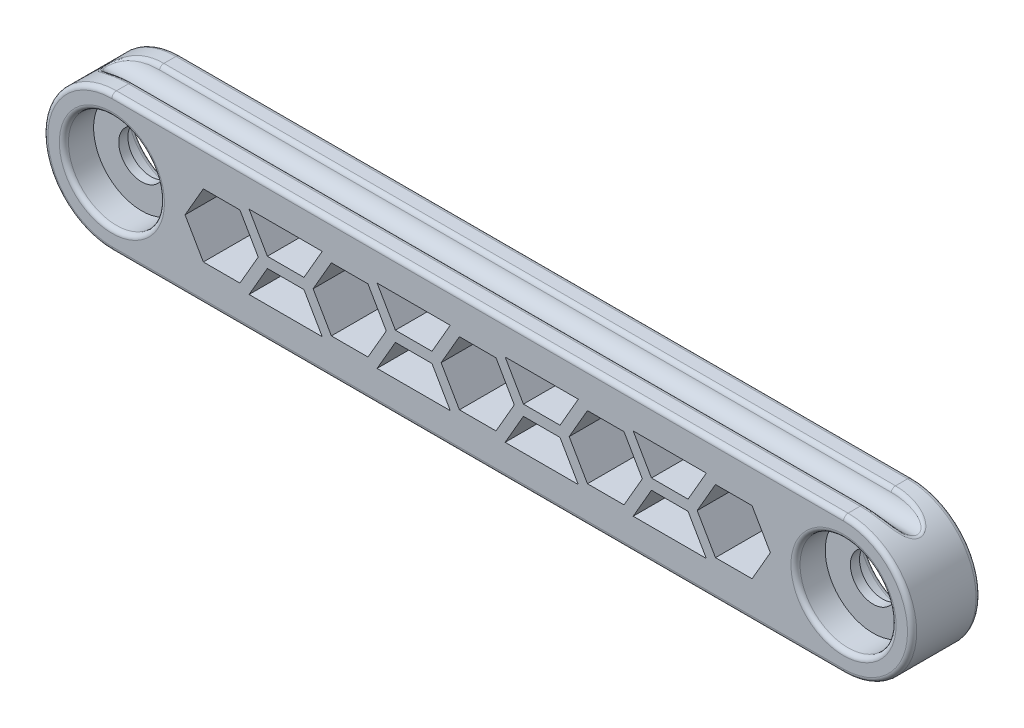
from build123d import *

# Parameters (mm, degrees)
SKETCH1_R               = 5
BOSS_EXTRUDE1_DEPTH     = 1
SKETCH1_3_R             = 10.5
BOSS_EXTRUDE2_DEPTH     = 7.5
CUT_EXTRUDE1_DEPTH      = 97.468906908
CUT_EXTRUDE1_DEPTH_BACK = 97.468906908
FILLET1_R               = 1
FILLET2_R               = 1
CUT_EXTRUDE3_DEPTH      = 97.468907022
CUT_EXTRUDE4_DEPTH      = 97.468907022
LPATTERN1_COUNT         = 3
LPATTERN1_PITCH         = 28
LPATTERN1_COUNT_DIR2    = 3
LPATTERN1_PITCH_DIR2    = 28
LPATTERN2_COUNT         = 2
LPATTERN2_PITCH         = 28
LPATTERN2_COUNT_DIR2    = 3
LPATTERN2_PITCH_DIR2    = 28


with BuildPart() as part:
    # Sketch1 → Boss-Extrude1 (new, symmetric)
    with BuildSketch(Plane.XY):
        with BuildLine():
            Line((80, 15), (-80, 15))
            ThreePointArc((-80, 15), (-95, 0), (-80, -15))
            Line((-80, -15), (80, -15))
            ThreePointArc((80, -15), (95, 0), (80, 15))
        make_face()
        with Locations((-80, 0)):
            Circle(SKETCH1_R, mode=Mode.SUBTRACT)
        with Locations((80, 0)):
            Circle(SKETCH1_R, mode=Mode.SUBTRACT)
    extrude(amount=BOSS_EXTRUDE1_DEPTH, both=True)

    # Sketch1<3> → Boss-Extrude2 (add, symmetric)
    with BuildSketch(Plane.XY):
        with BuildLine():
            Line((80, 15), (-80, 15))
            ThreePointArc((-80, 15), (-95, 0), (-80, -15))
            Line((-80, -15), (80, -15))
            ThreePointArc((80, -15), (95, 0), (80, 15))
        make_face()
        with Locations((-80, 0)):
            Circle(SKETCH1_3_R, mode=Mode.SUBTRACT)
        with Locations((80, 0)):
            Circle(SKETCH1_3_R, mode=Mode.SUBTRACT)
    extrude(amount=BOSS_EXTRUDE2_DEPTH, both=True)

    # Sketch2 → Cut-Extrude1 (cut, two sides: drawn at the far end of the back side and taken through both)
    with BuildSketch(Plane(origin=(0, 0, 0), x_dir=(0, 0, -1), z_dir=(1, 0, 0)).offset(-CUT_EXTRUDE1_DEPTH_BACK)):
        with BuildLine():
            Line((3, 15), (-3, 15))
            ThreePointArc((-3, 15), (0, 12), (3, 15))
        make_face()
    extrude(amount=CUT_EXTRUDE1_DEPTH + CUT_EXTRUDE1_DEPTH_BACK, mode=Mode.SUBTRACT)

    # Fillet1
    fillet1_edges = [part.edges().sort_by_distance(p)[0] for p in [
        (-89, 12, 0),
        (0, 15, 3),
        (88.9999999, 12.000000075, -0.000670821),
        (0, 15, -3),
    ]]
    fillet(fillet1_edges, radius=FILLET1_R)

    # Fillet2
    fillet2_edges = [part.edges().sort_by_distance(p)[0] for p in [
        (-95, 0, 7.5),
        (0, 15, 7.5),
        (95, 0, 7.5),
        (0, -15, 7.5),
        (-90.5, 0, 7.5),
        (69.5, 0, 7.5),
        (95, 0, -7.5),
        (0, 15, -7.5),
        (-95, 0, -7.5),
        (0, -15, -7.5),
        (-90.5, 0, -7.5),
        (69.5, 0, -7.5),
    ]]
    fillet(fillet2_edges, radius=FILLET2_R)

    # Sketch5 → Cut-Extrude3 (cut, symmetric)
    with BuildSketch(Plane.XY):
        Polygon((-4, -6.92820323), (4, -6.92820323), (8, 0), (4, 6.92820323), (-4, 6.92820323), (-8, 0), align=None)
    cut_extrude3 = extrude(amount=CUT_EXTRUDE3_DEPTH, both=True, mode=Mode.SUBTRACT)

    # Sketch5<3> → Cut-Extrude4 (cut, symmetric)
    with BuildSketch(Plane.XY):
        Polygon((22, 8.082903769), (6, 8.082903769), (10, 1.154700538), (18, 1.154700538), align=None)
        Polygon((18, -1.154700538), (10, -1.154700538), (6, -8.082903769), (22, -8.082903769), align=None)
    cut_extrude4 = extrude(amount=CUT_EXTRUDE4_DEPTH, both=True, mode=Mode.SUBTRACT)

    # LPattern1: Cut-Extrude3 3 × 3
    with Locations(*[Vector(1, 0, 0) * (i * LPATTERN1_PITCH) + Vector(-1, 0, 0) * (j * LPATTERN1_PITCH_DIR2) for i in range(LPATTERN1_COUNT) for j in range(LPATTERN1_COUNT_DIR2) if (i, j) != (0, 0)]):
        add(cut_extrude3, mode=Mode.SUBTRACT)

    # LPattern2: Cut-Extrude4 2 × 3
    with Locations(*[Vector(1, 0, 0) * (i * LPATTERN2_PITCH) + Vector(-1, 0, 0) * (j * LPATTERN2_PITCH_DIR2) for i in range(LPATTERN2_COUNT) for j in range(LPATTERN2_COUNT_DIR2) if (i, j) != (0, 0)]):
        add(cut_extrude4, mode=Mode.SUBTRACT)


solid = part.part
